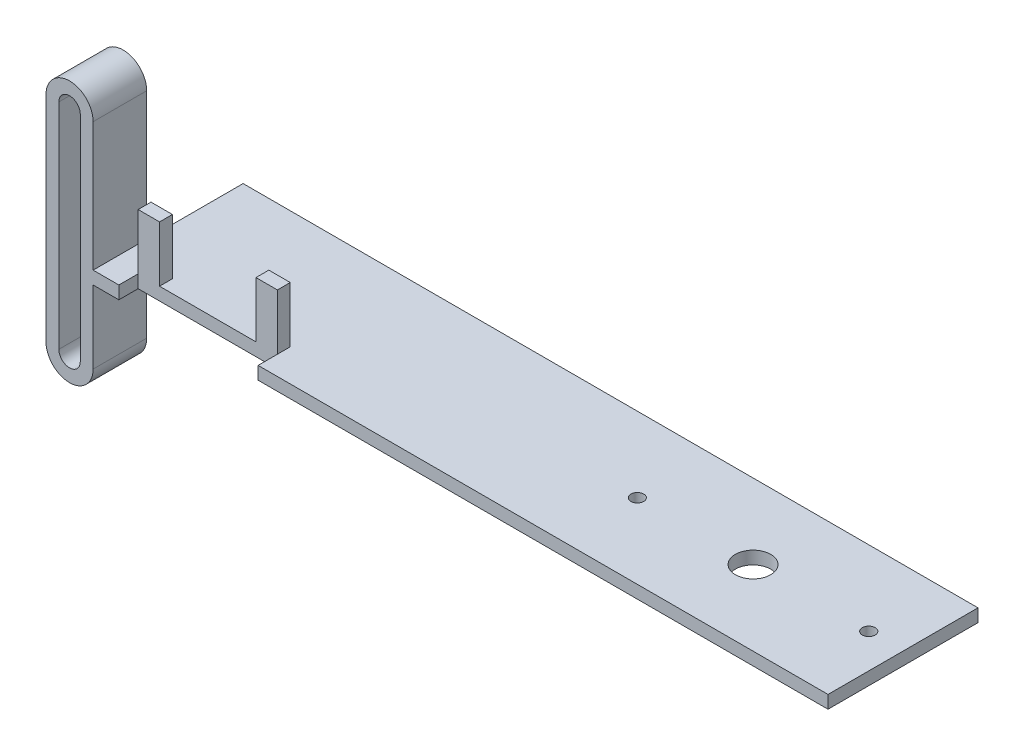
from build123d import *

# Parameters (mm, degrees)
SKETCH1_W              = 70
SKETCH1_H              = 12
SKETCH1_R              = 1.5
SKETCH1_R_2            = 4.125
BOSS_EXTRUDE1_DEPTH    = 3
BOSS_EXTRUDE2_DEPTH    = 12.5
CUT_EXTRUDE1_START     = -22.5
CUT_EXTRUDE1_OUTLINE_W = 5
CUT_EXTRUDE1_OUTLINE_H = 3
CUT_EXTRUDE1_DEPTH     = 35
CUT_EXTRUDE2_START     = -22.5
CUT_EXTRUDE2_DEPTH     = 22.5
CUT_EXTRUDE3_START     = 8
SKETCH2_5_W            = 32.5
SKETCH2_5_H            = 9.897866997
CUT_EXTRUDE3_DEPTH     = 4.5
SKETCH4_W              = 5
SKETCH4_H              = 13
BOSS_EXTRUDE3_DEPTH    = 3


# Read off the part's stored shape, not the designer's step: Cut-Extrude1
with BuildPart() as part:
    # Sketch1 → Boss-Extrude1 (new body)
    # profile 1 of 2: a face of its own
    with BuildSketch(Plane(origin=(0, 0, 0), x_dir=(1, 0, 0), z_dir=(0, 1, 0))):
        Polygon((82.5, 22.5), (-100, 22.5), (-100, -12.5), (82.5, -12.5), (82.5, -1), (12.5, -1), (12.5, 11), (82.5, 11), align=None)
    # profile 2 of 2: a face of its own
    with BuildSketch(Plane(origin=(0, 0, 0), x_dir=(1, 0, 0), z_dir=(0, 1, 0))):
        with Locations((47.5, 5)):
            Rectangle(SKETCH1_W, SKETCH1_H)
        with Locations(Location((20.5, 5, 0), (0, 0, 270))):
            Circle(SKETCH1_R, mode=Mode.SUBTRACT)
        with Locations(Location((47.5, 5, 0), (0, 0, 270))):
            Circle(SKETCH1_R_2, mode=Mode.SUBTRACT)
        with Locations(Location((74.5, 5, 0), (0, 0, 270))):
            Circle(SKETCH1_R, mode=Mode.SUBTRACT)
    extrude(amount=BOSS_EXTRUDE1_DEPTH)

    # Sketch2 → Boss-Extrude2 (add)
    with BuildSketch(Plane.XY):
        with BuildLine():
            Line((-89, 33), (-89, -17))
            ThreePointArc((-89, -17), (-94.5, -22.5), (-100, -17))
            Line((-100, -17), (-100, 33))
            ThreePointArc((-100, 33), (-94.5, 38.5), (-89, 33))
        make_face()
        with BuildLine():
            ThreePointArc((-97, -17), (-94.5, -19.5), (-92, -17))
            Line((-92, -17), (-92, 33))
            ThreePointArc((-92, 33), (-94.5, 35.5), (-97, 33))
            Line((-97, 33), (-97, -17))
        make_face(mode=Mode.SUBTRACT)
    extrude(amount=BOSS_EXTRUDE2_DEPTH)

    # Cut-Extrude1 outline → Cut-Extrude1 (cut)
    with BuildSketch(Plane.XY.offset(CUT_EXTRUDE1_START)):
        with Locations((-94.5, 1.5)):
            Rectangle(CUT_EXTRUDE1_OUTLINE_W, CUT_EXTRUDE1_OUTLINE_H)
    extrude(amount=CUT_EXTRUDE1_DEPTH, mode=Mode.SUBTRACT)

    # Sketch2<3> → Cut-Extrude2 (cut)
    with BuildSketch(Plane.XY.offset(CUT_EXTRUDE2_START)):
        with BuildLine():
            Line((-89, 33), (-89, -17))
            ThreePointArc((-89, -17), (-94.5, -22.5), (-100, -17))
            Line((-100, -17), (-100, 33))
            ThreePointArc((-100, 33), (-94.5, 38.5), (-89, 33))
        make_face()
        with BuildLine():
            ThreePointArc((-97, -17), (-94.5, -19.5), (-92, -17))
            Line((-92, -17), (-92, 33))
            ThreePointArc((-92, 33), (-94.5, 35.5), (-97, 33))
            Line((-97, 33), (-97, -17))
        make_face(mode=Mode.SUBTRACT)
    extrude(amount=CUT_EXTRUDE2_DEPTH, mode=Mode.SUBTRACT)

    # Sketch2<5> → Cut-Extrude3 (cut)
    with BuildSketch(Plane.XY.offset(CUT_EXTRUDE3_START)):
        with Locations((-66.75, 1.550857661)):
            Rectangle(SKETCH2_5_W, SKETCH2_5_H)
    extrude(amount=CUT_EXTRUDE3_DEPTH, mode=Mode.SUBTRACT)

    # Sketch4 → Boss-Extrude3 (add)
    with BuildSketch(Plane.XY.offset(8)):
        with Locations((-80.5, 9.5)):
            Rectangle(SKETCH4_W, SKETCH4_H)
        with Locations((-53, 9.5)):
            Rectangle(SKETCH4_W, SKETCH4_H)
    extrude(amount=-BOSS_EXTRUDE3_DEPTH)


solid = part.part
